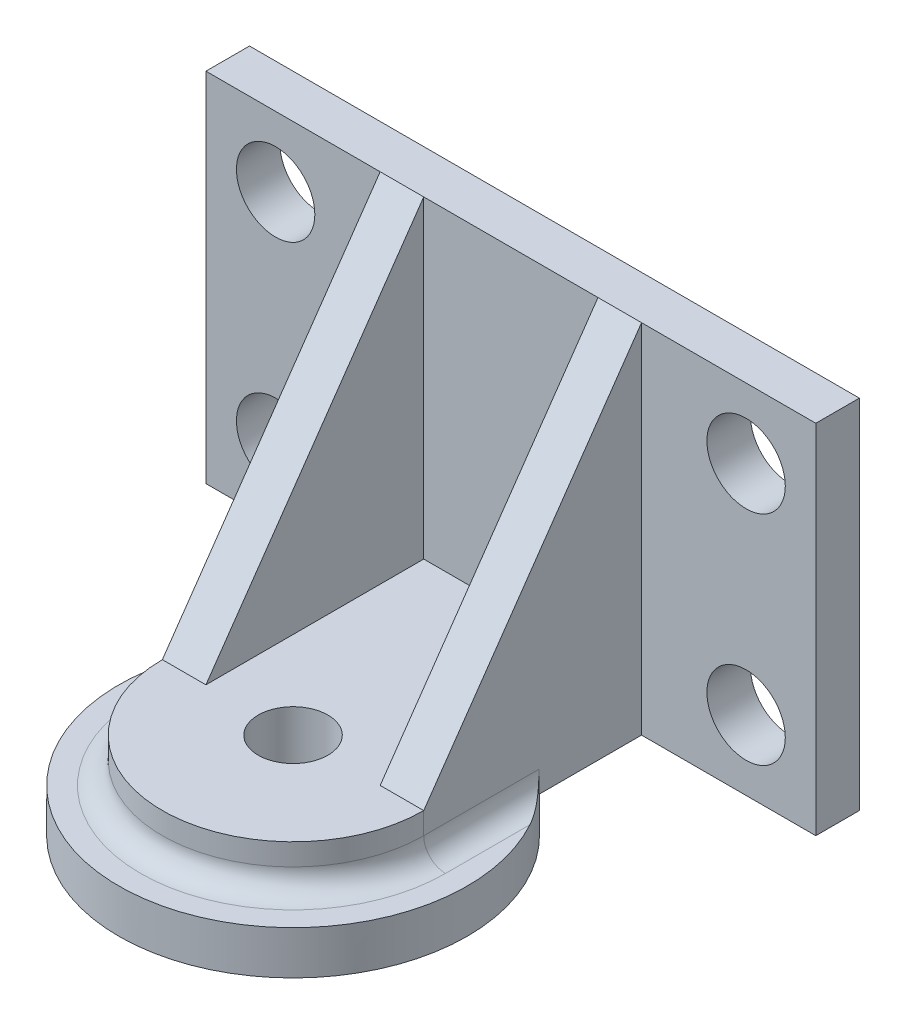
from build123d import *

# Parameters (mm, degrees)
SKETCH1_W               = 70
SKETCH1_H               = 41
SKETCH1_R               = 4.5
BOSS_EXTRUDE1_DEPTH     = 5
SKETCH2_W               = 5
SKETCH2_H               = 41
BOSS_EXTRUDE2_DEPTH     = 25
BOSS_EXTRUDE3_DEPTH     = 5
CUT_EXTRUDE2_DEPTH      = 61.582588258
CUT_EXTRUDE2_DEPTH_BACK = 61.582588258
SKETCH6_R               = 20
BOSS_EXTRUDE4_DEPTH     = 5
SKETCH7_R               = 4
CUT_EXTRUDE3_DEPTH      = 71.859014952
FILLET1_R               = 2.5


with BuildPart() as part:
    # Sketch1 → Boss-Extrude1 (new body)
    with BuildSketch(Plane.XY):
        Rectangle(SKETCH1_W, SKETCH1_H)
        with Locations((-27, 12.5)):
            Circle(SKETCH1_R, mode=Mode.SUBTRACT)
        with Locations((-27, -12.5)):
            Circle(SKETCH1_R, mode=Mode.SUBTRACT)
        with Locations((27, 12.5)):
            Circle(SKETCH1_R, mode=Mode.SUBTRACT)
        with Locations((27, -12.5)):
            Circle(SKETCH1_R, mode=Mode.SUBTRACT)
    extrude(amount=BOSS_EXTRUDE1_DEPTH)

    # Sketch2 → Boss-Extrude2 (add)
    with BuildSketch(Plane.XY.offset(5)):
        with Locations((-12.5, 0)):
            Rectangle(SKETCH2_W, SKETCH2_H)
        with Locations((12.5, 0)):
            Rectangle(SKETCH2_W, SKETCH2_H)
    extrude(amount=BOSS_EXTRUDE2_DEPTH)

    # Sketch5 → Boss-Extrude3 (add)
    with BuildSketch(Plane.XZ.offset(20.5)):
        with BuildLine():
            Line((-15, 30), (-15, 5))
            Line((-15, 5), (15, 5))
            Line((15, 5), (15, 30))
            ThreePointArc((15, 30), (0, 45), (-15, 30))
        make_face()
    extrude(amount=-BOSS_EXTRUDE3_DEPTH)

    # Sketch3 → Cut-Extrude2 (cut, two sides: drawn at the far end of the back side and taken through both)
    with BuildSketch(Plane(origin=(0, 0, 0), x_dir=(0, 0, -1), z_dir=(1, 0, 0)).offset(-CUT_EXTRUDE2_DEPTH_BACK)):
        Polygon((-5, 20.5), (-30, -15.5), (-49.542972481, -15.5), (-49.542972481, 23.944363396), (-5, 23.944363396), align=None)
    extrude(amount=CUT_EXTRUDE2_DEPTH + CUT_EXTRUDE2_DEPTH_BACK, mode=Mode.SUBTRACT)

    # Sketch6 → Boss-Extrude4 (add)
    with BuildSketch(Plane.XZ.offset(20.5)):
        with Locations(Location((0, 30, 0), (0, 0, 221.409622109))):
            Circle(SKETCH6_R)
    extrude(amount=BOSS_EXTRUDE4_DEPTH)

    # Sketch7 → Cut-Extrude3 (cut, through all)
    with BuildSketch(Plane(origin=(0, -15.5, 0), x_dir=(1, 0, 0), z_dir=(0, 1, 0))):
        with Locations(Location((0, -30, 0), (0, 0, 180))):
            Circle(SKETCH7_R)
    extrude(amount=-CUT_EXTRUDE3_DEPTH, mode=Mode.SUBTRACT)

    # Fillet1
    # the kernel refuses this fillet: 2.5 mm, written as the material it adds along each edge
    with BuildSketch(Plane(origin=(-15, -20.5, 10.521243445), x_dir=(0, 1, 0), z_dir=(0, 0, 1))) as fillet1_piece_1_section:
        with BuildLine():
            CenterArc((FILLET1_R, FILLET1_R), FILLET1_R, 180, 90)
            Line((0, FILLET1_R), (0, 0))
            Line((0, 0), (FILLET1_R, 0))
        make_face()
    fillet1_piece_1 = extrude(amount=19.478756555, mode=Mode.PRIVATE)
    fillet1_piece_1 = fillet1_piece_1 & Plane(origin=(0, -19.928453247, 30), x_dir=(-0.7500000000031269, 0, -0.6614378277626021), z_dir=(0, 1, 0)) * Cylinder(20, 49, mode=Mode.PRIVATE)
    add(fillet1_piece_1)
    with BuildSketch(Plane(origin=(15, -20.5, 10.521243445), x_dir=(0, 1, 0), z_dir=(0, 0, 1))) as fillet1_piece_2_section:
        with BuildLine():
            CenterArc((FILLET1_R, -FILLET1_R), FILLET1_R, 90, 90)
            Line((0, -FILLET1_R), (0, 0))
            Line((0, 0), (FILLET1_R, 0))
        make_face()
    fillet1_piece_2 = extrude(amount=19.478756555, mode=Mode.PRIVATE)
    fillet1_piece_2 = fillet1_piece_2 & Plane(origin=(0, -19.928453234, 30), x_dir=(-0.7500000000031269, 0, -0.6614378277626021), z_dir=(0, 1, 0)) * Cylinder(20, 49, mode=Mode.PRIVATE)
    add(fillet1_piece_2)
    with BuildSketch(Plane(origin=(0, -20.5, 30), x_dir=(1, 0, 0), z_dir=(0, 0, -1))) as fillet1_piece_3:
        with BuildLine():
            CenterArc((15 + FILLET1_R, -FILLET1_R), FILLET1_R, 90, 90)
            Line((15, -FILLET1_R), (15, 0))
            Line((15, 0), (15 + FILLET1_R, 0))
        make_face()
    revolve(axis=Axis((0, -20.5, 30), (0, -1, 0)), revolution_arc=180)


solid = part.part
